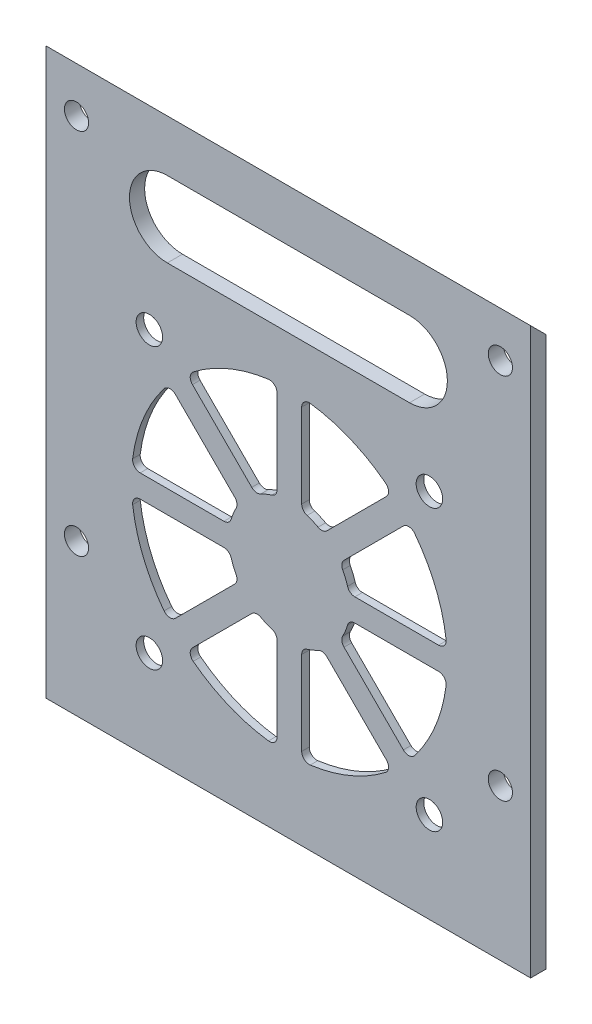
from build123d import *

# Parameters (mm, degrees)
SZKIC1_W                    = 64
SZKIC1_H                    = 2
SZKIC1_H_2                  = 72.64
DODANIE_WYCI_GNI_CIE1_DEPTH = 2
SFAZOWANIE1_SIZE            = 2
SZKIC2_R                    = 1.6
WYTNIJ_WYCI_GNI_CIE1_DEPTH  = 2
WYTNIJ_WYCI_GNI_CIE2_DEPTH  = 10
ZAOKR_GLENIE1_R             = 1
SZKIC4_R                    = 1.75
WYTNIJ_WYCI_GNI_CIE3_DEPTH  = 10
WYTNIJ_WYCI_GNI_CIE4_DEPTH  = 10
SZKIC6_W                    = 48
SZKIC6_H                    = 47
WYTNIJ_WYCI_GNI_CIE5_DEPTH  = 1


with BuildPart() as part:
    # Szkic1 → Dodanie-wyciągnięcie1 (new body)
    with BuildSketch(Plane.XY):
        with Locations((-32, 73.64)):
            Rectangle(SZKIC1_W, SZKIC1_H)
        with Locations((-32, 36.32)):
            Rectangle(SZKIC1_W, SZKIC1_H_2)
    extrude(amount=DODANIE_WYCI_GNI_CIE1_DEPTH)

    # Sfazowanie1
    sfazowanie1_edges = [part.edges().sort_by_distance(p)[0] for p in [
        (-32, 74.64, 0),
    ]]
    chamfer(sfazowanie1_edges, length=SFAZOWANIE1_SIZE - 0.0001)  # a hair under: the kernel refuses the full size

    # Szkic2 → Wytnij-wyciągnięcie1 (cut)
    with BuildSketch(Plane.XY.offset(2)):
        with Locations((-60, 20)):
            Circle(SZKIC2_R)
        with Locations((-4, 20)):
            Circle(SZKIC2_R)
        with Locations((-4, 68.64)):
            Circle(SZKIC2_R)
        with Locations((-60, 68.64)):
            Circle(SZKIC2_R)
    extrude(amount=-WYTNIJ_WYCI_GNI_CIE1_DEPTH, mode=Mode.SUBTRACT)

    # Szkic3 → Wytnij-wyciągnięcie2 (cut)
    with BuildSketch(Plane(origin=(0, 0, 0), x_dir=(-1, 0, 0), z_dir=(0, 0, -1))):
        with BuildLine():
            Line((11.056403618, 32), (24.016552746, 32))
            ThreePointArc((24.016552746, 32), (24.466137465, 33.518882587), (25.206174928, 34.919409376))
            Line((25.206174928, 34.919409376), (16.034132153, 44.091452151))
            ThreePointArc((16.034132153, 44.091452151), (12.573950156, 38.445591693), (11.056403618, 32))
        make_face()
        with BuildLine():
            ThreePointArc((25.206174928, 26.080590624), (24.466137465, 27.481117413), (24.016552746, 29))
            Line((24.016552746, 29), (11.056403618, 29))
            ThreePointArc((11.056403618, 29), (12.573950156, 22.554408307), (16.034132153, 16.908547849))
            Line((16.034132153, 16.908547849), (25.206174928, 26.080590624))
        make_face()
        with BuildLine():
            ThreePointArc((27.455260193, 37.168494641), (28.795563732, 37.883705523), (30.246904647, 38.332648426))
            Line((30.246904647, 38.332648426), (30.246904647, 51.308665948))
            ThreePointArc((30.246904647, 51.308665948), (23.86987617, 49.77624133), (18.283217418, 46.340537416))
            Line((18.283217418, 46.340537416), (27.455260193, 37.168494641))
        make_face()
        with BuildLine():
            ThreePointArc((33.50243449, 38.332648426), (34.953775405, 37.883705523), (36.294078944, 37.168494641))
            Line((36.294078944, 37.168494641), (45.466121719, 46.340537416))
            ThreePointArc((45.466121719, 46.340537416), (39.879462967, 49.77624133), (33.50243449, 51.308665948))
            Line((33.50243449, 51.308665948), (33.50243449, 38.332648426))
        make_face()
        with BuildLine():
            ThreePointArc((38.543164209, 34.919409376), (39.283201672, 33.518882587), (39.732786391, 32))
            Line((39.732786391, 32), (52.692935519, 32))
            ThreePointArc((52.692935519, 32), (51.175388981, 38.445591693), (47.715206984, 44.091452151))
            Line((47.715206984, 44.091452151), (38.543164209, 34.919409376))
        make_face()
        with BuildLine():
            Line((52.692935519, 29), (39.732786391, 29))
            ThreePointArc((39.732786391, 29), (39.283201672, 27.481117413), (38.543164209, 26.080590624))
            Line((38.543164209, 26.080590624), (47.715206984, 16.908547849))
            ThreePointArc((47.715206984, 16.908547849), (51.175388981, 22.554408307), (52.692935519, 29))
        make_face()
        with BuildLine():
            Line((45.466121719, 14.659462584), (36.294078944, 23.831505359))
            ThreePointArc((36.294078944, 23.831505359), (34.953775405, 23.116294477), (33.50243449, 22.667351574))
            Line((33.50243449, 22.667351574), (33.50243449, 9.691334052))
            ThreePointArc((33.50243449, 9.691334052), (39.879462967, 11.22375867), (45.466121719, 14.659462584))
        make_face()
        with BuildLine():
            Line((30.246904647, 9.691334052), (30.246904647, 22.667351574))
            ThreePointArc((30.246904647, 22.667351574), (28.795563732, 23.116294477), (27.455260193, 23.831505359))
            Line((27.455260193, 23.831505359), (18.283217418, 14.659462584))
            ThreePointArc((18.283217418, 14.659462584), (23.86987617, 11.22375867), (30.246904647, 9.691334052))
        make_face()
    extrude(amount=-WYTNIJ_WYCI_GNI_CIE2_DEPTH, mode=Mode.SUBTRACT)

    # Zaokrąglenie1
    zaokr_glenie1_edges = [part.edges().sort_by_distance(p)[0] for p in [
        (-36.294078944, 37.168494641, 1),
        (-33.50243449, 38.332648426, 1),
        (-33.50243449, 51.308665948, 1),
        (-45.466121719, 46.340537416, 1),
        (-33.50243449, 22.667351574, 1),
        (-36.294078944, 23.831505359, 1),
        (-45.466121719, 14.659462584, 1),
        (-33.50243449, 9.691334052, 1),
        (-38.543164209, 26.080590624, 1),
        (-39.732786391, 29, 1),
        (-52.692935519, 29, 1),
        (-47.715206984, 16.908547849, 1),
        (-27.455260193, 23.831505359, 1),
        (-30.246904647, 22.667351574, 1),
        (-30.246904647, 9.691334052, 1),
        (-18.283217418, 14.659462584, 1),
        (-25.206174928, 34.919409376, 1),
        (-24.016552746, 32, 1),
        (-11.056403618, 32, 1),
        (-16.034132153, 44.091452151, 1),
        (-24.016552746, 29, 1),
        (-25.206174928, 26.080590624, 1),
        (-16.034132153, 16.908547849, 1),
        (-11.056403618, 29, 1),
        (-30.246904647, 38.332648426, 1),
        (-27.455260193, 37.168494641, 1),
        (-18.283217418, 46.340537416, 1),
        (-30.246904647, 51.308665948, 1),
        (-39.732786391, 32, 1),
        (-38.543164209, 34.919409376, 1),
        (-47.715206984, 44.091452151, 1),
        (-52.692935519, 32, 1),
    ]]
    fillet(zaokr_glenie1_edges, radius=ZAOKR_GLENIE1_R)

    # Szkic4 → Wytnij-wyciągnięcie3 (cut)
    with BuildSketch(Plane(origin=(0, 0, 0), x_dir=(-1, 0, 0), z_dir=(0, 0, -1))):
        with Locations((13.374669569, 49)):
            Circle(SZKIC4_R)
        with Locations((50.374669569, 49)):
            Circle(SZKIC4_R)
        with Locations((50.374669569, 12)):
            Circle(SZKIC4_R)
        with Locations((13.374669569, 12)):
            Circle(SZKIC4_R)
    extrude(amount=-WYTNIJ_WYCI_GNI_CIE3_DEPTH, mode=Mode.SUBTRACT)

    # Szkic5 → Wytnij-wyciągnięcie4 (cut)
    with BuildSketch(Plane(origin=(0, 0, 0), x_dir=(-1, 0, 0), z_dir=(0, 0, -1))):
        with BuildLine():
            Line((16.000918864, 67.82), (48, 67.82))
            ThreePointArc((48, 67.82), (53, 62.82), (48, 57.82))
            Line((48, 57.82), (16.000918864, 57.82))
            ThreePointArc((16.000918864, 57.82), (11.000918864, 62.82), (16.000918864, 67.82))
        make_face()
    extrude(amount=-WYTNIJ_WYCI_GNI_CIE4_DEPTH, mode=Mode.SUBTRACT)

    # Szkic6 → Wytnij-wyciągnięcie5 (cut)
    with BuildSketch(Plane(origin=(0, 0, 0), x_dir=(-1, 0, 0), z_dir=(0, 0, -1))):
        with Locations((32, 31.5)):
            Rectangle(SZKIC6_W, SZKIC6_H)
    extrude(amount=-WYTNIJ_WYCI_GNI_CIE5_DEPTH, mode=Mode.SUBTRACT)


solid = part.part
